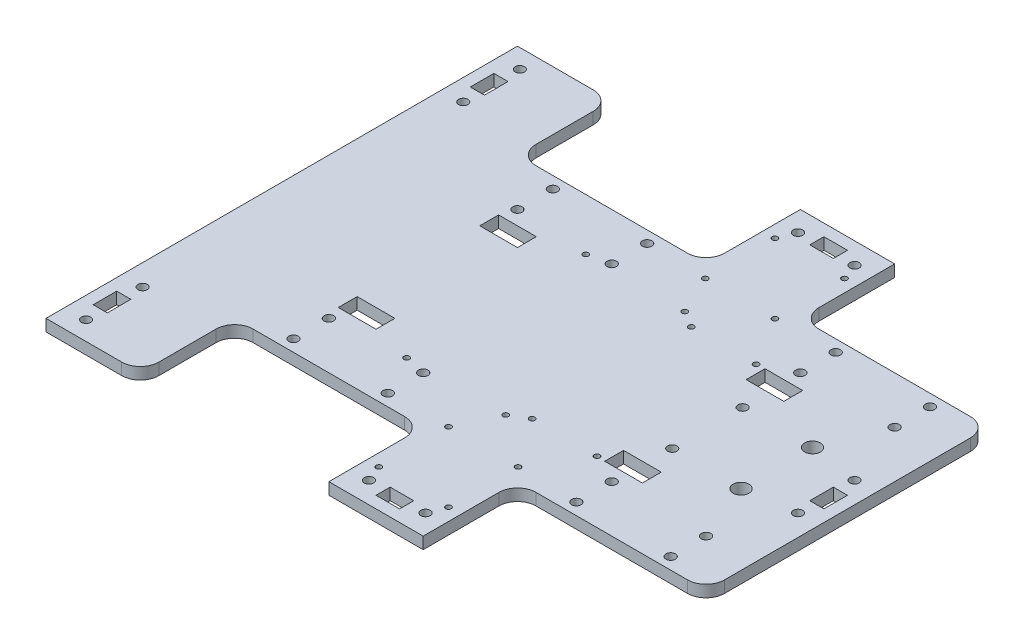
from build123d import *

# Parameters (mm, degrees)
BOSS_EXTRUDE1_DEPTH   = 6.35
SKETCH2_W             = 12.7
SKETCH2_H             = 7.62
CUT_EXTRUDE1_DEPTH    = 326.340686819
SKETCH3_R             = 2.54
CUT_EXTRUDE2_DEPTH    = 326.340686819
F_5_0MM_DOWEL_HOLE1_D = 5
SKETCH6_W             = 12.7
SKETCH6_H             = 7.62
SKETCH6_W_2           = 7.62
SKETCH6_H_2           = 12.7
CUT_EXTRUDE3_DEPTH    = 326.340686819
SKETCH7_W             = 20.32
SKETCH7_H             = 10.16
CUT_EXTRUDE4_DEPTH    = 326.340686819
F_3_0MM_DOWEL_HOLE1_D = 3
F_8_0MM_DOWEL_HOLE1_D = 8.5
FILLET1_R             = 10


with BuildPart() as part:
    # Sketch1 → Boss-Extrude1 (new body)
    with BuildSketch(Plane(origin=(0, 0, 0), x_dir=(1, 0, 0), z_dir=(0, 1, 0))):
        Polygon((0, 152.4), (101.6, 152.4), (101.6, 203.2), (152.4, 203.2), (152.4, 152.4), (254, 152.4), (254, 0), (152.4, 0), (152.4, -50.8), (101.6, -50.8), (101.6, 0), (0, 0), (0, -50.8), (-50.8, -50.8), (-50.8, 203.2), (0, 203.2), align=None)
    extrude(amount=BOSS_EXTRUDE1_DEPTH)

    # Sketch2 → Cut-Extrude1 (cut, through all)
    with BuildSketch(Plane(origin=(0, 6.35, 0), x_dir=(1, 0, 0), z_dir=(0, 1, 0))):
        with Locations((127, 193.04)):
            Rectangle(SKETCH2_W, SKETCH2_H)
    extrude(amount=-CUT_EXTRUDE1_DEPTH, mode=Mode.SUBTRACT)

    # Sketch3 → Cut-Extrude2 (cut, through all)
    with BuildSketch(Plane.XZ):
        with Locations((228.6, -146.05)):
            Circle(SKETCH3_R)
        with Locations((177.8, -146.05)):
            Circle(SKETCH3_R)
        with Locations((228.6, -127)):
            Circle(SKETCH3_R)
        with Locations((177.8, -127)):
            Circle(SKETCH3_R)
        with Locations((177.8, -25.4)):
            Circle(SKETCH3_R)
        with Locations((228.6, -25.4)):
            Circle(SKETCH3_R)
        with Locations((177.8, -6.35)):
            Circle(SKETCH3_R)
        with Locations((228.6, -6.35)):
            Circle(SKETCH3_R)
        with Locations((25.4, -6.35)):
            Circle(SKETCH3_R)
        with Locations((76.2, -6.35)):
            Circle(SKETCH3_R)
        with Locations((25.4, -25.4)):
            Circle(SKETCH3_R)
        with Locations((76.2, -25.4)):
            Circle(SKETCH3_R)
        with Locations((76.2, -127)):
            Circle(SKETCH3_R)
        with Locations((25.4, -127)):
            Circle(SKETCH3_R)
        with Locations((76.2, -146.05)):
            Circle(SKETCH3_R)
        with Locations((25.4, -146.05)):
            Circle(SKETCH3_R)
        with Locations((142.24, -191.77)):
            Circle(SKETCH3_R)
        with Locations((111.76, -191.77)):
            Circle(SKETCH3_R)
        with Locations((142.24, 39.37)):
            Circle(SKETCH3_R)
        with Locations((111.76, 39.37)):
            Circle(SKETCH3_R)
    extrude(amount=-CUT_EXTRUDE2_DEPTH, mode=Mode.SUBTRACT)

    # Ø5.0mm Dowel Hole1 (through all)
    with Locations(Plane(origin=(-39.37, 6.35, 40.64), x_dir=(0, 0, 1), z_dir=(0, 1, 0))):
        with Locations((0, 0), (-30.48, 0), (-203.2, 0), (-233.68, 0), (-101.6, 281.94), (-132.08, 281.94), (-135.89, 217.806113179), (-97.790581471, 218.016607204)):
            Hole(F_5_0MM_DOWEL_HOLE1_D / 2)

    # Sketch6 → Cut-Extrude3 (cut, through all)
    with BuildSketch(Plane(origin=(0, 6.35, 0), x_dir=(1, 0, 0), z_dir=(0, 1, 0))):
        with Locations((127, -40.64)):
            Rectangle(SKETCH6_W, SKETCH6_H)
        with Locations((-40.64, -25.4)):
            Rectangle(SKETCH6_W_2, SKETCH6_H_2)
        with Locations((-40.64, 177.8)):
            Rectangle(SKETCH6_W_2, SKETCH6_H_2)
        with Locations((243.84, 76.2)):
            Rectangle(SKETCH6_W_2, SKETCH6_H_2)
    extrude(amount=-CUT_EXTRUDE3_DEPTH, mode=Mode.SUBTRACT)

    # Sketch7 → Cut-Extrude4 (cut, through all)
    with BuildSketch(Plane(origin=(0, 6.35, 0), x_dir=(1, 0, 0), z_dir=(0, 1, 0))):
        with Locations((33.02, 38.1)):
            Rectangle(SKETCH7_W, SKETCH7_H)
        with Locations((33.02, 114.3)):
            Rectangle(SKETCH7_W, SKETCH7_H)
        with Locations((176.53, 38.1)):
            Rectangle(SKETCH7_W, SKETCH7_H)
        with Locations((176.53, 114.3)):
            Rectangle(SKETCH7_W, SKETCH7_H)
    extrude(amount=-CUT_EXTRUDE4_DEPTH, mode=Mode.SUBTRACT)

    # Ø3.0mm Dowel Hole1 (through all)
    with Locations(Plane(origin=(161.925, 6.35, -33.3375), x_dir=(0, 0, 1), z_dir=(0, 1, 0))):
        with Locations((0, 0), (-85.725, 0), (-85.725, -34.925), (0, -34.925), (-91.1225, -43.815), (5.3975, -43.815), (5.3975, -97.155), (-91.1225, -97.155), (-149.5425, -53.731928242), (-112.0425, -53.731928242), (-112.0425, -16.231928242), (-149.5425, -16.231928242), (63.8175, -16.231928242), (63.8175, -53.731928242), (26.3175, -53.731928242), (26.3175, -16.231928242)):
            Hole(F_3_0MM_DOWEL_HOLE1_D / 2)

    # Ø8.0mm Dowel Hole1 (through all)
    with Locations(Plane(origin=(215.9, 6.35, -56.950000019), x_dir=(0, 0, 1), z_dir=(0, 1, 0))):
        with Locations((0, 0), (-38.499999962, 0)):
            Hole(F_8_0MM_DOWEL_HOLE1_D / 2)

    # Fillet1
    fillet1_edges = [part.edges().sort_by_distance(p)[0] for p in [
        (101.6, 3.175, -152.4),
        (0, 3.175, -203.2),
        (0, 3.175, -152.4),
        (0, 3.175, 50.8),
        (0, 3.175, 0),
        (101.6, 3.175, 0),
        (152.4, 3.175, 0),
        (254, 3.175, 0),
        (152.4, 3.175, -152.4),
        (254, 3.175, -152.4),
    ]]
    fillet(fillet1_edges, radius=FILLET1_R)


solid = part.part
